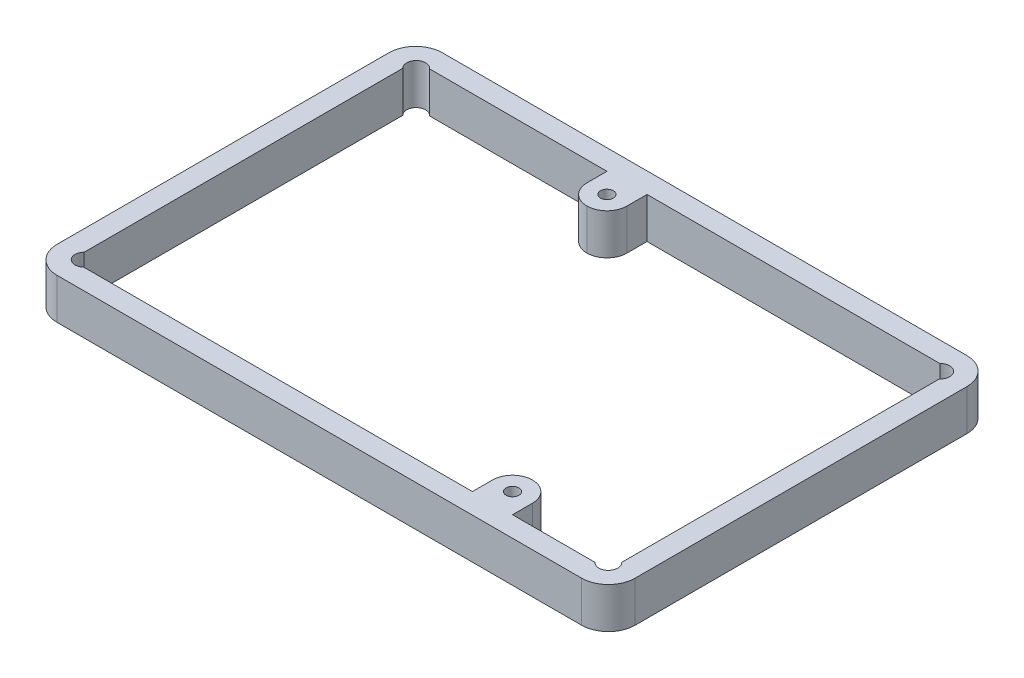
from build123d import *

# Parameters (mm, degrees)
BOSS_EXTRUDE3_DEPTH = 6.35
SKETCH3_W           = 6.24
SKETCH3_H           = 6.35
BOSS_EXTRUDE4_DEPTH = 6.24
FILLET1_R           = 3.12
SKETCH4_R           = 1
CUT_EXTRUDE1_DEPTH  = 55.454774814
SKETCH5_R           = 1.4224
SKETCH5_R_2         = 1.4732
CUT_EXTRUDE2_DEPTH  = 55.454774814
SKETCH6_W           = 6.24
SKETCH6_H           = 6.35
BOSS_EXTRUDE5_DEPTH = 6.24
SKETCH7_R           = 1
CUT_EXTRUDE3_DEPTH  = 55.454774814
FILLET3_R           = 3.12


with BuildPart() as part:
    # Sketch2 → Boss-Extrude3 (new body)
    with BuildSketch(Plane(origin=(0, 0, 0), x_dir=(1, 0, 0), z_dir=(0, 1, 0))):
        with BuildLine():
            Line((-45, 25.825), (-45, -25.825))
            ThreePointArc((-45, -25.825), (-43.777170811, -28.777170811), (-40.825, -30))
            Line((-40.825, -30), (40.825, -30))
            ThreePointArc((40.825, -30), (43.777170811, -28.777170811), (45, -25.825))
            Line((45, -25.825), (45, 25.825))
            ThreePointArc((45, 25.825), (43.777170811, 28.777170811), (40.825, 30))
            Line((40.825, 30), (-40.825, 30))
            ThreePointArc((-40.825, 30), (-43.777170811, 28.777170811), (-45, 25.825))
        make_face()
        with BuildLine():
            Line((-41.825, -25.825), (-41.825, 25.825))
            ThreePointArc((-41.825, 25.825), (-41.532106781, 26.532106781), (-40.825, 26.825))
            Line((-40.825, 26.825), (40.825, 26.825))
            ThreePointArc((40.825, 26.825), (41.532106781, 26.532106781), (41.825, 25.825))
            Line((41.825, 25.825), (41.825, -25.825))
            ThreePointArc((41.825, -25.825), (41.532106781, -26.532106781), (40.825, -26.825))
            Line((40.825, -26.825), (-40.825, -26.825))
            ThreePointArc((-40.825, -26.825), (-41.532106781, -26.532106781), (-41.825, -25.825))
        make_face(mode=Mode.SUBTRACT)
    extrude(amount=BOSS_EXTRUDE3_DEPTH)

    # Sketch3 → Boss-Extrude4 (add)
    with BuildSketch(Plane(origin=(-7.875425543, 0, 26.825), x_dir=(-1, 0, 0), z_dir=(0, 0, -1))):
        with Locations((-31.660425543, 3.175)):
            Rectangle(SKETCH3_W, SKETCH3_H)
    extrude(amount=BOSS_EXTRUDE4_DEPTH)

    # Fillet1
    fillet1_edges = [part.edges().sort_by_distance(p)[0] for p in [
        (20.665, 3.175, 20.585),
        (26.905, 3.175, 20.585),
    ]]
    fillet(fillet1_edges, radius=FILLET1_R - 0.0001)  # a hair under: the kernel refuses the full size

    # Sketch4 → Cut-Extrude1 (cut, through all)
    with BuildSketch(Plane.XZ):
        with Locations(Location((23.785, 23.705, 0), (0, 0, 270))):
            Circle(SKETCH4_R)
    extrude(amount=-CUT_EXTRUDE1_DEPTH, mode=Mode.SUBTRACT)

    # Sketch5 → Cut-Extrude2 (cut, through all)
    with BuildSketch(Plane.XZ):
        with Locations((-40.824987904, 25.779417466)):
            Circle(SKETCH5_R)
        with Locations((40.825, 25.825)):
            Circle(SKETCH5_R_2)
        with Locations((40.86022953, -25.814867613)):
            Circle(SKETCH5_R_2)
        with Locations((-40.789751469, -25.870570514)):
            Circle(SKETCH5_R_2)
    extrude(amount=-CUT_EXTRUDE2_DEPTH, mode=Mode.SUBTRACT)

    # Sketch6 → Boss-Extrude5 (add)
    with BuildSketch(Plane.XY.offset(-26.825)):
        with Locations((-8.92393673, 3.175)):
            Rectangle(SKETCH6_W, SKETCH6_H)
    extrude(amount=BOSS_EXTRUDE5_DEPTH)

    # Sketch7 → Cut-Extrude3 (cut, through all)
    with BuildSketch(Plane(origin=(0, 0, 0), x_dir=(-1, 0, 0), z_dir=(0, -1, 0))):
        with Locations(Location((8.92393673, 23.705, 0), (0, 0, 90))):
            Circle(SKETCH7_R)
    extrude(amount=-CUT_EXTRUDE3_DEPTH, mode=Mode.SUBTRACT)

    # Fillet3
    fillet3_edges = [part.edges().sort_by_distance(p)[0] for p in [
        (-5.80393673, 3.175, -20.585),
        (-12.04393673, 3.175, -20.585),
    ]]
    fillet(fillet3_edges, radius=FILLET3_R - 0.0001)  # a hair under: the kernel refuses the full size


solid = part.part
